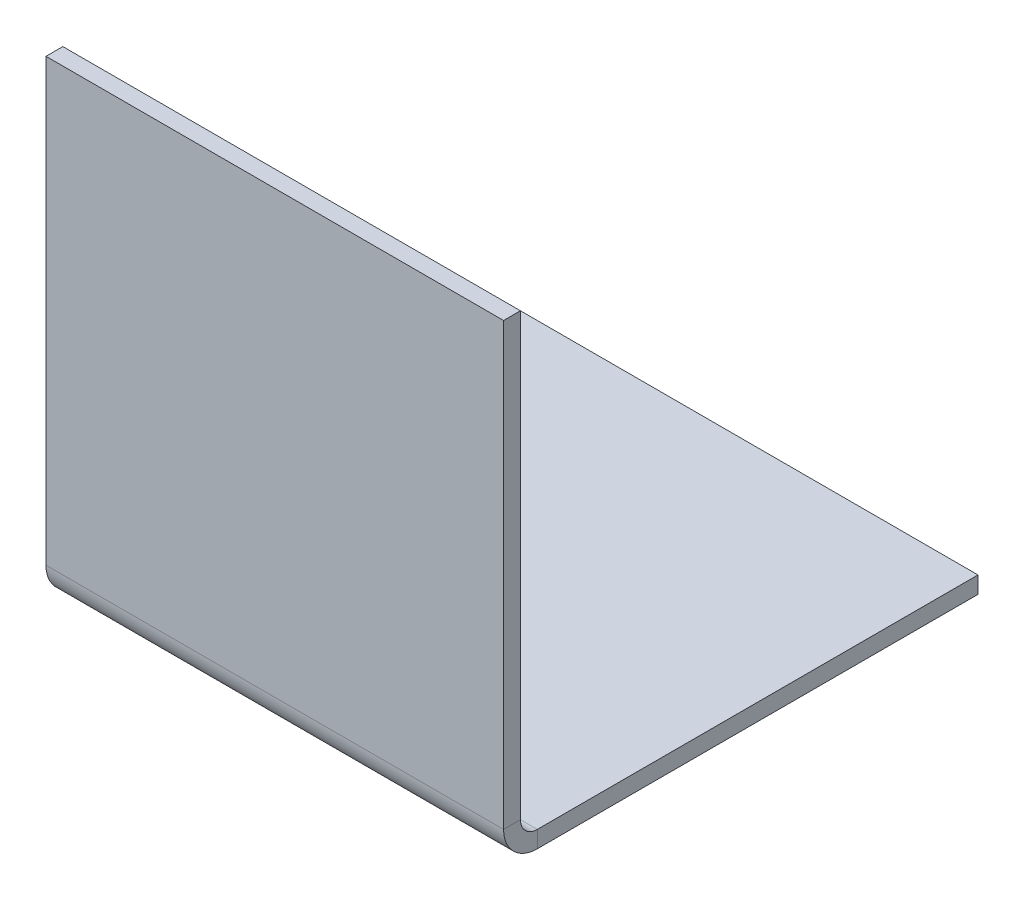
from build123d import *

# Parameters (mm, degrees)
SKETCH1_W                    = 20
SKETCH1_H                    = 20
BASE_FLANGE1_DEPTH           = 0.7366
EDGE_FLANGE1_STRIP_W         = 4.4196
EDGE_FLANGE1_STRIP_H         = 0.7366
EDGE_FLANGE1_STRIP_CUT_DEPTH = 20
EDGE_FLANGE1_DEPTH           = 20


# Sheet-metal steps are written as plain solids
with BuildPart() as part:
    # Sketch1 → Base-Flange1 (new body)
    with BuildSketch(Plane(origin=(0, 0, 0), x_dir=(1, 0, 0), z_dir=(0, 1, 0))):
        Rectangle(SKETCH1_W, SKETCH1_H)
    extrude(amount=-BASE_FLANGE1_DEPTH)

    # Edge-Flange1 strip (across the edge) → Edge-Flange1 strip cut (cut)
    with BuildSketch(Plane(origin=(-10, 0, 10), x_dir=(0, 0, -1), z_dir=(1, 0, 0))):
        with Locations((-1.4732, -0.3683)):
            Rectangle(EDGE_FLANGE1_STRIP_W, EDGE_FLANGE1_STRIP_H)
    extrude(amount=EDGE_FLANGE1_STRIP_CUT_DEPTH, mode=Mode.SUBTRACT)

    # Edge-Flange1 section (across the edge) → Edge-Flange1 (add)
    with BuildSketch(Plane(origin=(-10, 0, 10), x_dir=(0, 0, -1), z_dir=(1, 0, 0))):
        with BuildLine():
            Line((-0.7366, 0.7366), (-0.7366, 20))
            Line((-0.7366, 20), (0, 20))
            Line((0, 20), (0, 0.7366))
            ThreePointArc((0, 0.7366), (0.215745145, 0.215745145), (0.7366, 0))
            Line((0.7366, 0), (0.7366, -0.7366))
            ThreePointArc((0.7366, -0.7366), (-0.30510971, -0.30510971), (-0.7366, 0.7366))
        make_face()
    extrude(amount=EDGE_FLANGE1_DEPTH)


solid = part.part
